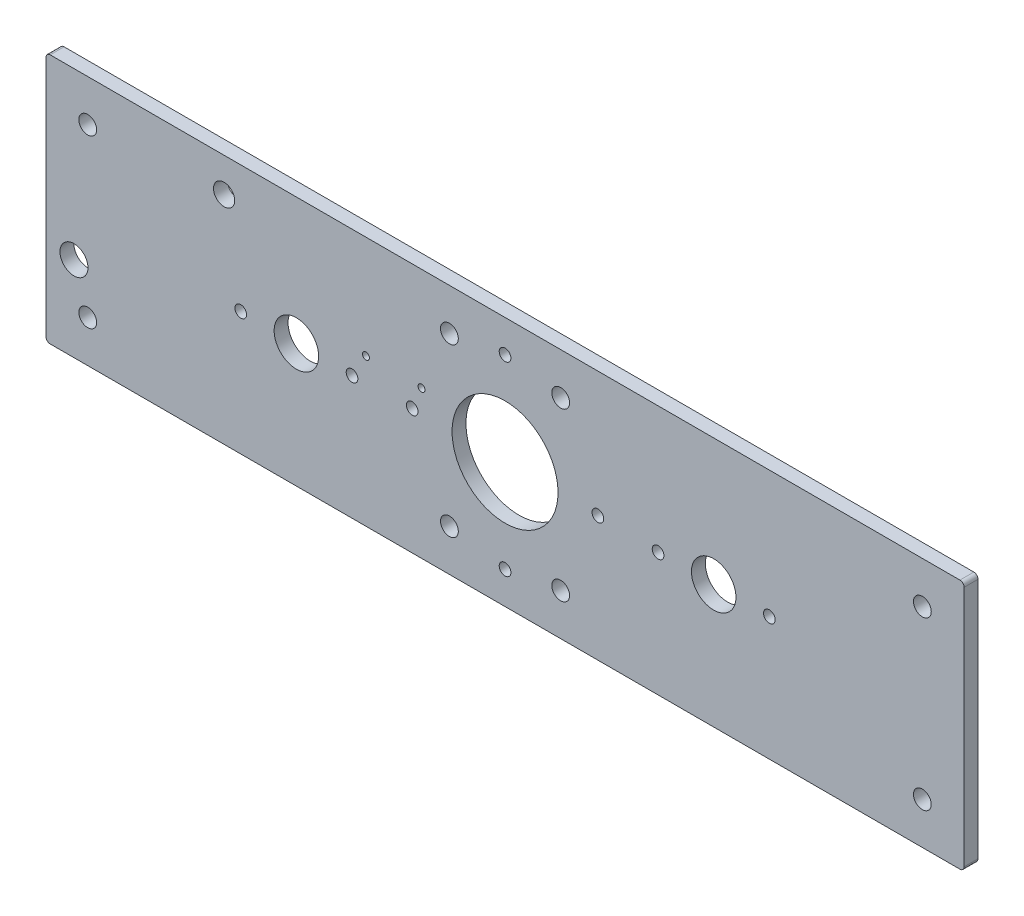
from build123d import *

# Parameters (mm, degrees)
SKETCH1_W             = 330
SKETCH1_H             = 90
SKETCH1_R             = 19.05
BOSS_EXTRUDE1_DEPTH   = 2.5
M6_CLEARANCE_HOLE1_D  = 6.4
SKETCH3_R             = 8
CUT_EXTRUDE2_DEPTH    = 172.099386323
M5X0_8_TAPPED_HOLE1_D = 4.2
M5X0_8_TAPPED_HOLE3_D = 4.2
FILLET1_R             = 1.5
M3X0_5_TAPPED_HOLE1_D = 2.5
SKETCH13_R            = 3.812820203
CUT_EXTRUDE3_DEPTH    = 172.099386323
SKETCH14_R            = 5.027775544
CUT_EXTRUDE4_DEPTH    = 10


with BuildPart() as part:
    # Sketch1 → Boss-Extrude1 (new, symmetric)
    with BuildSketch(Plane.XY):
        Rectangle(SKETCH1_W, SKETCH1_H)
        Circle(SKETCH1_R, mode=Mode.SUBTRACT)
    extrude(amount=BOSS_EXTRUDE1_DEPTH, both=True)

    # M6 Clearance Hole1 (through all)
    with Locations(Plane.XY.offset(2.5)):
        with Locations((-150, 30), (-20, 30), (-20, -30), (-150, -30)):
            m6_clearance_hole1 = Hole(M6_CLEARANCE_HOLE1_D / 2)

    # Mirror2: M6 Clearance Hole1 across plane
    add(m6_clearance_hole1.mirror(Plane(origin=(0, 0, 0), x_dir=(0, 0, 1), z_dir=(1, 0, 0))), mode=Mode.SUBTRACT)

    # Sketch3 → Cut-Extrude2 (cut, through all)
    with BuildSketch(Plane.XY.offset(2.5)):
        with Locations((-75, -0.6)):
            Circle(SKETCH3_R)
    cut_extrude2 = extrude(amount=-CUT_EXTRUDE2_DEPTH, mode=Mode.SUBTRACT)

    # M5x0.8 Tapped Hole1 (through all)
    with Locations(Plane.XY.offset(2.5)):
        with Locations((-95, -0.6), (-55, -0.6)):
            m5x0_8_tapped_hole1 = Hole(M5X0_8_TAPPED_HOLE1_D / 2)

    # Mirror1: Cut-Extrude2, M5x0.8 Tapped Hole1 across plane
    add(cut_extrude2.mirror(Plane(origin=(0, 0, 0), x_dir=(0, 0, 1), z_dir=(1, 0, 0))), mode=Mode.SUBTRACT)
    add(m5x0_8_tapped_hole1.mirror(Plane(origin=(0, 0, 0), x_dir=(0, 0, 1), z_dir=(1, 0, 0))), mode=Mode.SUBTRACT)

    # M5x0.8 Tapped Hole3 (through all)
    with Locations(Plane.XY.offset(2.5)):
        with Locations((0, 33.375440072), (0, -33.375440072), (-33.375440072, 0), (33.375440072, 0)):
            Hole(M5X0_8_TAPPED_HOLE3_D / 2)

    # Fillet1
    fillet1_edges = [part.edges().sort_by_distance(p)[0] for p in [
        (-165, -45, 0),
        (165, -45, 0),
        (165, 45, 0),
        (-165, 45, 0),
    ]]
    fillet(fillet1_edges, radius=FILLET1_R)

    # M3x0.5 Tapped Hole1 (through all)
    with Locations(Plane.XY.offset(2.5)):
        with Locations((-50, 8), (-30, 8)):
            Hole(M3X0_5_TAPPED_HOLE1_D / 2)

    # Sketch13 → Cut-Extrude3 (cut, through all)
    with BuildSketch(Plane.XY.offset(2.5)):
        with Locations((-100.98991849, 32.782067782)):
            Circle(SKETCH13_R)
    extrude(amount=-CUT_EXTRUDE3_DEPTH, mode=Mode.SUBTRACT)

    # Sketch14 → Cut-Extrude4 (cut)
    with BuildSketch(Plane.XY.offset(2.5)):
        with Locations((-154.944784256, -14.507326579)):
            Circle(SKETCH14_R)
    extrude(amount=-CUT_EXTRUDE4_DEPTH, mode=Mode.SUBTRACT)


solid = part.part
